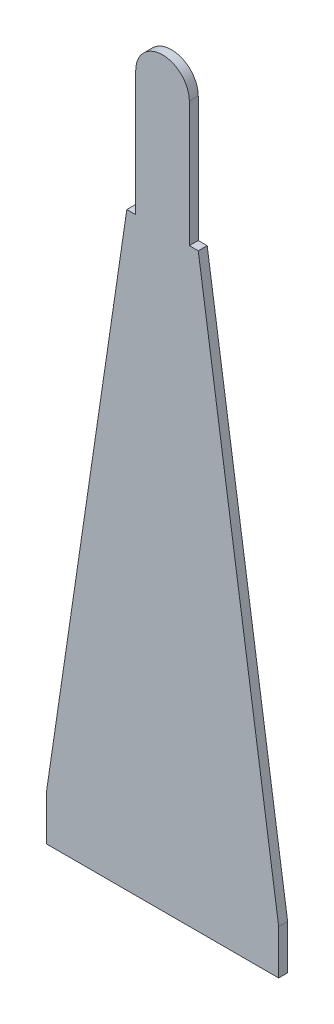
from build123d import *

# Parameters (mm, degrees)
AUFSATZ_LINEAR_AUSTRAGEN1_DEPTH = 10


with BuildPart() as part:
    # Skizze1 → Aufsatz-Linear austragen1 (new body)
    with BuildSketch(Plane.XY):
        with BuildLine():
            Line((-40, 660), (-130, 50))
            Line((-130, 50), (-130, 0))
            Line((-130, 0), (0, 0))
            Line((0, 0), (0, 800))
            Line((0, 800), (0, 830))
            ThreePointArc((0, 830), (-21.213203436, 821.213203436), (-30, 800))
            Line((-30, 800), (-30, 660))
            Line((-30, 660), (-40, 660))
        make_face()
    aufsatz_linear_austragen1 = extrude(amount=AUFSATZ_LINEAR_AUSTRAGEN1_DEPTH)

    # Spiegeln1: Aufsatz-Linear austragen1 across plane
    add(aufsatz_linear_austragen1.mirror(Plane(origin=(0, 800, 10), x_dir=(0, 0, 1), z_dir=(1, 0, 0))))


solid = part.part
